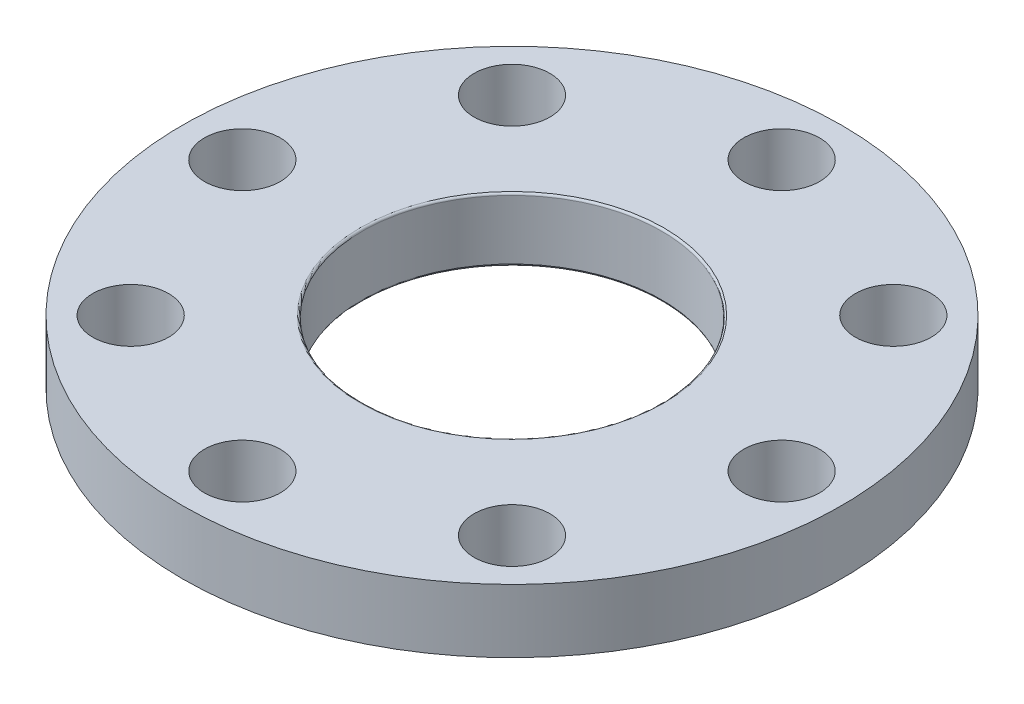
from build123d import *

# Parameters (mm, degrees)
SKETCH1_R           = 16.5
SKETCH1_R_2         = 7.5
BOSS_EXTRUDE1_DEPTH = 3.175
FILLET1_R           = 0.1
SKETCH2_R           = 1.89865
CUT_EXTRUDE1_DEPTH  = 24.549535558
CIRPATTERN1_COUNT   = 8


with BuildPart() as part:
    # Sketch1 → Boss-Extrude1 (new body)
    with BuildSketch(Plane(origin=(0, 0, 0), x_dir=(1, 0, 0), z_dir=(0, 1, 0))):
        Circle(SKETCH1_R)
        Circle(SKETCH1_R_2, mode=Mode.SUBTRACT)
    extrude(amount=BOSS_EXTRUDE1_DEPTH)

    # Fillet1
    fillet1_edges = [part.edges().sort_by_distance(p)[0] for p in [
        (-7.5, 0, 0),
        (-7.5, 3.175, 0),
    ]]
    fillet(fillet1_edges, radius=FILLET1_R)

    # Sketch2 → Cut-Extrude1 (cut, through all)
    with BuildSketch(Plane(origin=(0, 3.175, 0), x_dir=(-1, 0, 0), z_dir=(0, 1, 0))):
        with Locations((0, -13.5)):
            Circle(SKETCH2_R)
    cut_extrude1 = extrude(amount=-CUT_EXTRUDE1_DEPTH, mode=Mode.SUBTRACT)

    # CirPattern1: Cut-Extrude1 ×8 about axis
    cirpattern1_axis = Axis((0, 3.175, 0), (0, -1, 0))
    for i in range(1, CIRPATTERN1_COUNT):
        add(cut_extrude1.rotate(cirpattern1_axis, i * 360 / CIRPATTERN1_COUNT), mode=Mode.SUBTRACT)


solid = part.part
